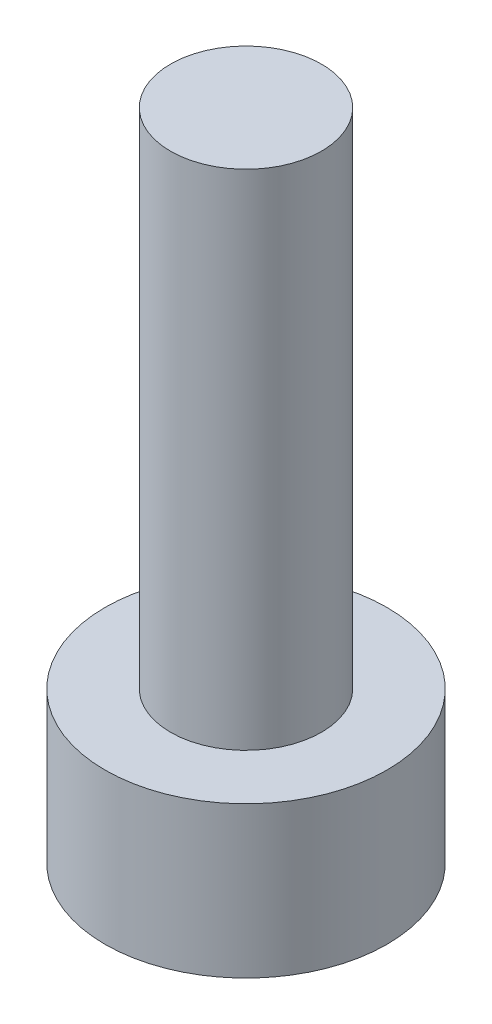
from build123d import *

# Parameters (mm, degrees)
SKETCH_1_R          = 2.8
EXTRUDE_1_DEPTH     = 3
SKETCH_2_R          = 1.5
EXTRUDE_2_DEPTH     = 10
CUT_EXTRUDE_1_DEPTH = 1.5


with BuildPart() as part:
    # 草图1 → 凸台-拉伸1 (new body)
    with BuildSketch(Plane(origin=(0, 0, 0), x_dir=(1, 0, 0), z_dir=(0, 1, 0))):
        Circle(SKETCH_1_R)
    extrude(amount=EXTRUDE_1_DEPTH)

    # 草图2 → 凸台-拉伸2 (add)
    with BuildSketch(Plane(origin=(0, 3, 0), x_dir=(1, 0, 0), z_dir=(0, 1, 0))):
        Circle(SKETCH_2_R)
    extrude(amount=EXTRUDE_2_DEPTH)

    # 草图3 → 切除-拉伸1 (cut)
    with BuildSketch(Plane.XZ):
        Polygon((1.084583442, -0.952371824), (1.367069914, 0.463090901), (0.282486472, 1.415462725), (-1.084583442, 0.952371824), (-1.367069914, -0.463090901), (-0.282486472, -1.415462725), align=None)
    extrude(amount=-CUT_EXTRUDE_1_DEPTH, mode=Mode.SUBTRACT)


solid = part.part
